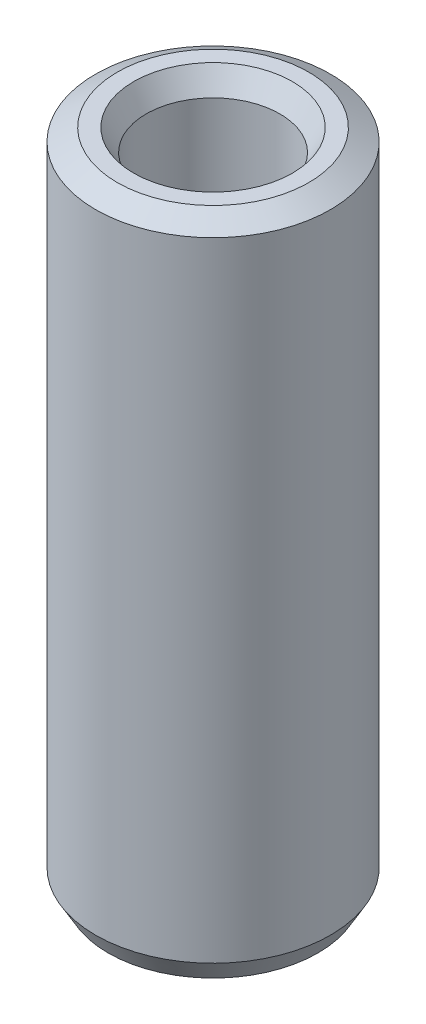
from build123d import *
from OCP.BRepFilletAPI import BRepFilletAPI_MakeChamfer

# Parameters (mm, degrees)
SKETCH1_R           = 20
BOSS_EXTRUDE1_DEPTH = 112.831708048
SKETCH2_R           = 11.379984714
CUT_EXTRUDE1_DEPTH  = 117.322802326
CHAMFER1_SIZE       = 2.134618492
CHAMFER1_SIZE2      = 3.697267683


with BuildPart() as part:
    # Sketch1 → Boss-Extrude1 (new body)
    with BuildSketch(Plane(origin=(0, 0, 0), x_dir=(1, 0, 0), z_dir=(0, 1, 0))):
        Circle(SKETCH1_R)
    extrude(amount=BOSS_EXTRUDE1_DEPTH)

    # Sketch2 → Cut-Extrude1 (cut, through all)
    with BuildSketch(Plane(origin=(0, 0, 0), x_dir=(1, 0, 0), z_dir=(0, 1, 0))):
        Circle(SKETCH2_R)
    extrude(amount=CUT_EXTRUDE1_DEPTH, mode=Mode.SUBTRACT)

    # Chamfer1: one chamfer whose edges measure the first distance from different faces: ONE call of the kernel's chamfer builder (chamfer() names one face for all edges)
    chamfer1_edges_1 = [part.edges().sort_by_distance(p)[0] for p in [
        (-11.379984714, 112.831708048, 0),
    ]]
    chamfer1_side_1 = [part.faces().sort_by_distance(p)[0] for p in [
        (-19.434314575, 112.831708048, 0),
    ]]
    chamfer1_edges_2 = [part.edges().sort_by_distance(p)[0] for p in [
        (-11.379984714, 0, 0),
    ]]
    chamfer1_side_2 = [part.faces().sort_by_distance(p)[0] for p in [
        (-11.379984714, 56.415854024, 0),
    ]]
    chamfer1_edges_3 = [part.edges().sort_by_distance(p)[0] for p in [
        (-20, 0, 0),
    ]]
    chamfer1_side_3 = [part.faces().sort_by_distance(p)[0] for p in [
        (-19.434314575, 0, 0),
    ]]
    chamfer1_edges_4 = [part.edges().sort_by_distance(p)[0] for p in [
        (-20, 112.831708048, 0),
    ]]
    chamfer1_side_4 = [part.faces().sort_by_distance(p)[0] for p in [
        (-20, 56.415854024, 0),
    ]]
    chamfer1 = BRepFilletAPI_MakeChamfer(part.part.solid().wrapped)
    for e in chamfer1_edges_1:
        chamfer1.Add(CHAMFER1_SIZE, CHAMFER1_SIZE2, e.wrapped, chamfer1_side_1[0].wrapped)  # the first distance lies on this face
    for e in chamfer1_edges_2:
        chamfer1.Add(CHAMFER1_SIZE, CHAMFER1_SIZE2, e.wrapped, chamfer1_side_2[0].wrapped)  # the first distance lies on this face
    for e in chamfer1_edges_3:
        chamfer1.Add(CHAMFER1_SIZE, CHAMFER1_SIZE2, e.wrapped, chamfer1_side_3[0].wrapped)  # the first distance lies on this face
    for e in chamfer1_edges_4:
        chamfer1.Add(CHAMFER1_SIZE, CHAMFER1_SIZE2, e.wrapped, chamfer1_side_4[0].wrapped)  # the first distance lies on this face
    add(Compound.cast(chamfer1.Shape()), mode=Mode.REPLACE)


solid = part.part
